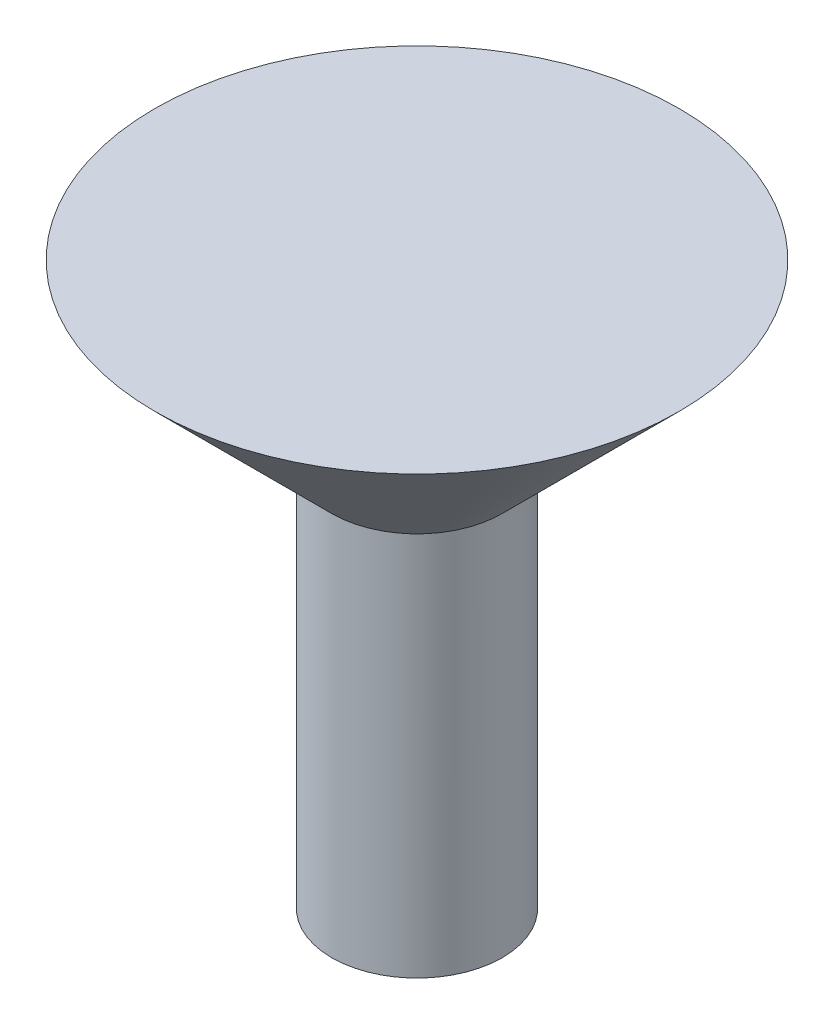
from build123d import *

# Parameters (mm, degrees)
SKETCH2_R           = 2.217157288
BOSS_EXTRUDE1_DEPTH = 10
SKETCH3_R           = 1.05
BOSS_EXTRUDE2_DEPTH = 3
SKETCH3_2_R         = 1.05
CUT_EXTRUDE1_DEPTH  = 6
FILLET1_R           = 1
CHAMFER1_SIZE       = 0.5


with BuildPart() as part:
    # Sketch1 → Revolve1 (revolve)
    with BuildSketch(Plane.XY):
        Polygon((-0.2, 2.3), (-0.2, -2.3), (-2.417157288, -2.3), (-7.017157288, 2.3), align=None)
    revolve(axis=Axis((-0.2, 2.3, 0), (0, -1, 0)))

    # Sketch2 → Boss-Extrude1 (add)
    with BuildSketch(Plane.XZ.offset(2.3)):
        with Locations((-0.2, 0)):
            Circle(SKETCH2_R)
    extrude(amount=BOSS_EXTRUDE1_DEPTH)

    # Sketch3 → Boss-Extrude2 (add)
    with BuildSketch(Plane.XZ.offset(12.3)):
        with Locations((-0.2, 0)):
            Circle(SKETCH3_R)
    extrude(amount=-BOSS_EXTRUDE2_DEPTH)

    # Sketch3<2> → Cut-Extrude1 (cut)
    with BuildSketch(Plane.XZ.offset(12.3)):
        with Locations((-0.2, 0)):
            Circle(SKETCH3_2_R)
    extrude(amount=-CUT_EXTRUDE1_DEPTH, mode=Mode.SUBTRACT)

    # Fillet1
    fillet1_edges = [part.edges().sort_by_distance(p)[0] for p in [
        (-1.25, -6.3, 0),
    ]]
    fillet(fillet1_edges, radius=FILLET1_R)

    # Chamfer1
    chamfer1_edges = [part.edges().sort_by_distance(p)[0] for p in [
        (-1.25, -12.3, 0),
    ]]
    chamfer(chamfer1_edges, length=CHAMFER1_SIZE)


solid = part.part
